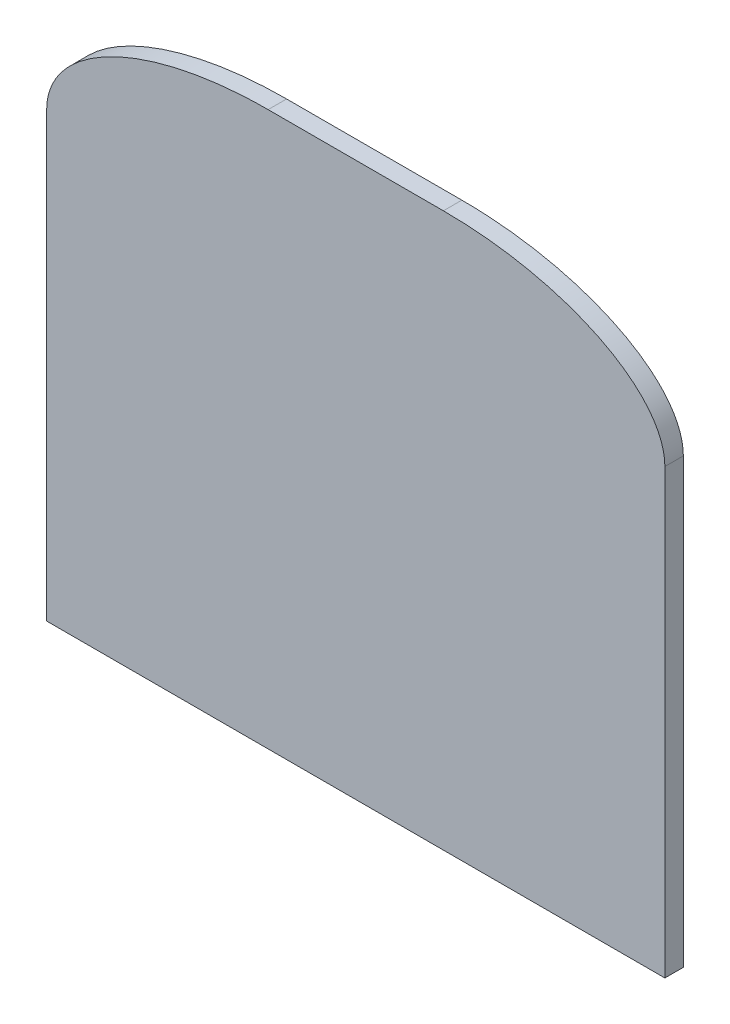
from build123d import *

# Parameters (mm, degrees)
BOSS_EXTRUDE1_DEPTH      = 212.7
BOSS_EXTRUDE1_DEPTH_BACK = 212.7
SKETCH2_W                = 12.7
SKETCH2_H                = 381
FILLET1_SIZE             = 152.4
FILLET1_SIZE_2           = 76.2


with BuildPart() as part:
    # Sketch2 → Boss-Extrude1 (new, two sides: drawn at the far end of the back side and taken through both)
    with BuildSketch(Plane(origin=(0, 0, 0), x_dir=(0, 0, -1), z_dir=(1, 0, 0)).offset(-BOSS_EXTRUDE1_DEPTH_BACK)):
        with Locations((-6.35, 212.725)):
            Rectangle(SKETCH2_W, SKETCH2_H)
    extrude(amount=BOSS_EXTRUDE1_DEPTH + BOSS_EXTRUDE1_DEPTH_BACK)

    # Fillet1
    # an asymmetric fillet: 152.4, 76.2 mm, written as the material it takes off along each edge
    with BuildSketch(Plane(origin=(212.7, 403.225, 393.7), x_dir=(-1, 0, 0), z_dir=(0, 0, -1))) as fillet1_piece_1:
        with BuildLine():
            Bezier((FILLET1_SIZE, 0), (0, 0), (0, -FILLET1_SIZE_2), weights=[1, 0.707106781, 1])
            Line((0, -FILLET1_SIZE_2), (0, 0))
            Line((0, 0), (FILLET1_SIZE, 0))
        make_face()
    extrude(amount=774.7, mode=Mode.SUBTRACT)
    with BuildSketch(Plane(origin=(-212.7, 403.225, 393.7), x_dir=(1, 0, 0), z_dir=(0, 0, -1))) as fillet1_piece_2:
        with BuildLine():
            Bezier((FILLET1_SIZE, 0), (0, 0), (0, FILLET1_SIZE_2), weights=[1, 0.707106781, 1])
            Line((0, FILLET1_SIZE_2), (0, 0))
            Line((0, 0), (FILLET1_SIZE, 0))
        make_face()
    extrude(amount=774.7, mode=Mode.SUBTRACT)


solid = part.part
